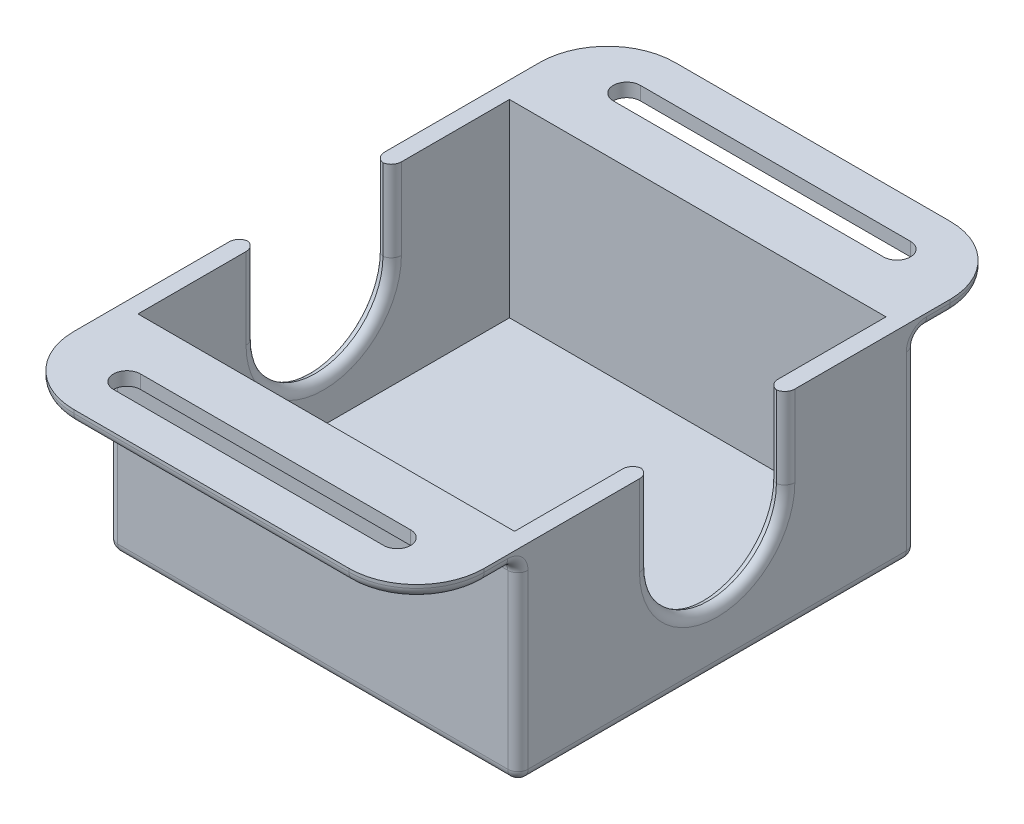
from build123d import *

# Parameters (mm, degrees)
BOSS_EXTRUDE1_DEPTH      = 27.5
BOSS_EXTRUDE1_DEPTH_BACK = 27.5
SKETCH3_W                = 60.75
SKETCH3_H                = 30.5
BOSS_EXTRUDE2_DEPTH      = 2
SKETCH4_W                = 55.75
SKETCH4_H                = 55
CUT_EXTRUDE1_DEPTH       = 50
SKETCH5_W                = 60.75
SKETCH5_H                = 30.5
BOSS_EXTRUDE3_DEPTH      = 2
SKETCH7_W                = 5.5
SKETCH7_H                = 4
CUT_EXTRUDE2_DEPTH       = 2
SKETCH8_W                = 60.75
SKETCH8_H                = 15
BOSS_EXTRUDE5_DEPTH      = 2
FILLET2_R                = 10
CUT_EXTRUDE3_DEPTH       = 62.425895394
CUT_EXTRUDE3_DEPTH_BACK  = 62.425895394
SKETCH10_W               = 5.5
SKETCH10_H               = 5.017361003
CUT_EXTRUDE4_DEPTH       = 4
DELETEFACE1_START        = -29
DELETEFACE1_OUTLINE_W    = 5.5
DELETEFACE1_OUTLINE_H    = 4
DELETEFACE1_DEPTH        = 2
SKETCH11_W               = 46.425527042
SKETCH11_H               = 17.437880889
BOSS_EXTRUDE6_DEPTH      = 0.8
FILLET3_R                = 1.5


# Read off the part's stored shape, not the designer's step: DeleteFace1
with BuildPart() as part:
    # Sketch2 → Boss-Extrude1 (new, two sides: drawn at the far end of the back side and taken through both)
    with BuildSketch(Plane.XY.offset(-BOSS_EXTRUDE1_DEPTH_BACK)):
        Polygon((-23.875, -1.5), (-27.875, -1.5), (-27.875, -27), (0, -27), (27.875, -27), (27.875, -1.5), (23.875, -1.5), (23.875, 1), (30.375, 1), (30.375, -29.5), (0, -29.5), (-30.375, -29.5), (-30.375, 1), (-23.875, 1), align=None)
    extrude(amount=BOSS_EXTRUDE1_DEPTH + BOSS_EXTRUDE1_DEPTH_BACK)

    # Sketch3 → Boss-Extrude2 (add)
    with BuildSketch(Plane(origin=(0, 0, -27.5), x_dir=(-1, 0, 0), z_dir=(0, 0, -1))):
        with Locations((0, -14.25)):
            Rectangle(SKETCH3_W, SKETCH3_H)
    extrude(amount=BOSS_EXTRUDE2_DEPTH)

    # Sketch4 → Cut-Extrude1 (cut)
    with BuildSketch(Plane(origin=(0, -27, 0), x_dir=(1, 0, 0), z_dir=(0, 1, 0))):
        Rectangle(SKETCH4_W, SKETCH4_H)
    extrude(amount=CUT_EXTRUDE1_DEPTH, mode=Mode.SUBTRACT)

    # Sketch5 → Boss-Extrude3 (add)
    with BuildSketch(Plane.XY.offset(27.5)):
        with Locations((0, -14.25)):
            Rectangle(SKETCH5_W, SKETCH5_H)
    extrude(amount=BOSS_EXTRUDE3_DEPTH)

    # Sketch7 → Cut-Extrude2 (cut)
    with BuildSketch(Plane(origin=(0, -27, 0), x_dir=(1, 0, 0), z_dir=(0, 1, 0))):
        with Locations((0, 20)):
            Rectangle(SKETCH7_W, SKETCH7_H)
        with Locations((17.5, 20)):
            Rectangle(SKETCH7_W, SKETCH7_H)
        with Locations((-17.5, 20)):
            Rectangle(SKETCH7_W, SKETCH7_H)
    extrude(amount=-CUT_EXTRUDE2_DEPTH, mode=Mode.SUBTRACT)

    # Sketch8 → Boss-Extrude5 (add)
    # profile 1 of 2: a face of its own
    with BuildSketch(Plane(origin=(0, 1, 0), x_dir=(1, 0, 0), z_dir=(0, 1, 0))):
        with Locations((0, 37)):
            Rectangle(SKETCH8_W, SKETCH8_H)
        with BuildLine():
            Line((-20, 39), (20, 39))
            ThreePointArc((20, 39), (22, 37), (20, 35))
            Line((20, 35), (-20, 35))
            ThreePointArc((-20, 35), (-22, 37), (-20, 39))
        make_face(mode=Mode.SUBTRACT)
    # profile 2 of 2: a face of its own
    with BuildSketch(Plane(origin=(0, 1, 0), x_dir=(1, 0, 0), z_dir=(0, 1, 0))):
        with Locations((0, -37)):
            Rectangle(SKETCH8_W, SKETCH8_H)
        with BuildLine():
            Line((-20, -35), (20, -35))
            ThreePointArc((20, -35), (22, -37), (20, -39))
            Line((20, -39), (-20, -39))
            ThreePointArc((-20, -39), (-22, -37), (-20, -35))
        make_face(mode=Mode.SUBTRACT)
    extrude(amount=-BOSS_EXTRUDE5_DEPTH)

    # Fillet2
    fillet2_edges = [part.edges().sort_by_distance(p)[0] for p in [
        (-30.375, 0, -44.5),
        (30.375, 0, -44.5),
        (-30.375, 0, 44.5),
        (30.375, 0, 44.5),
    ]]
    fillet(fillet2_edges, radius=FILLET2_R)

    # Sketch9 → Cut-Extrude3 (cut, two sides: drawn at the far end of the back side and taken through both)
    with BuildSketch(Plane(origin=(0, 0, 0), x_dir=(0, 0, -1), z_dir=(1, 0, 0)).offset(-CUT_EXTRUDE3_DEPTH_BACK)):
        with BuildLine():
            Line((10, 13), (10, -11))
            ThreePointArc((10, -11), (0, -21), (-10, -11))
            Line((-10, -11), (-10, 13))
            ThreePointArc((-10, 13), (0, 23), (10, 13))
        make_face()
    extrude(amount=CUT_EXTRUDE3_DEPTH + CUT_EXTRUDE3_DEPTH_BACK, mode=Mode.SUBTRACT)

    # Sketch10 → Cut-Extrude4 (cut)
    with BuildSketch(Plane(origin=(0, 0, -18), x_dir=(-1, 0, 0), z_dir=(0, 0, -1))):
        with Locations((17.5, -30.308680501)):
            Rectangle(SKETCH10_W, SKETCH10_H)
        with Locations((-17.5, -30.308680501)):
            Rectangle(SKETCH10_W, SKETCH10_H)
    extrude(amount=CUT_EXTRUDE4_DEPTH, mode=Mode.SUBTRACT)

    # DeleteFace1 outline → DeleteFace1 (add)
    with BuildSketch(Plane(origin=(0, 0, 0), x_dir=(1, 0, 0), z_dir=(0, 1, 0)).offset(DELETEFACE1_START)):
        with Locations((0, 20)):
            Rectangle(DELETEFACE1_OUTLINE_W, DELETEFACE1_OUTLINE_H)
    extrude(amount=DELETEFACE1_DEPTH)

    # Sketch11 → Boss-Extrude6 (add)
    with BuildSketch(Plane(origin=(0, -27, 0), x_dir=(1, 0, 0), z_dir=(0, 1, 0))):
        with Locations((0, 15.626153005)):
            Rectangle(SKETCH11_W, SKETCH11_H)
    extrude(amount=-BOSS_EXTRUDE6_DEPTH)

    # Fillet3
    # the kernel refuses this fillet: 1.5 mm, written as the material it adds along each edge
    with BuildSketch(Plane(origin=(-30.375, -1, 29.5), x_dir=(0, 0, 1), z_dir=(1, 0, 0)), Plane(origin=(-30.375, -1, -29.5), x_dir=(0, -1, 0), z_dir=(1, 0, 0))) as fillet3_piece_1:
        with BuildLine():
            CenterArc((FILLET3_R, FILLET3_R), FILLET3_R, 180, 90)
            Line((0, FILLET3_R), (0, 0))
            Line((0, 0), (FILLET3_R, 0))
        make_face()
    extrude(amount=60.75)
    # the kernel refuses this fillet: 1.5 mm, written as the material it takes off along each edge
    with BuildSketch(Plane(origin=(-30.375, -29.5, -33.25), x_dir=(0, 1, 0), z_dir=(0, 0, 1)), Plane(origin=(30.375, -29.5, 33.25), x_dir=(0, 1, 0), z_dir=(0, 0, -1))) as fillet3_2_piece_1:
        with BuildLine():
            CenterArc((FILLET3_R, -FILLET3_R), FILLET3_R, 90, 90)
            Line((0, -FILLET3_R), (0, 0))
            Line((0, 0), (FILLET3_R, 0))
        make_face()
    extrude(amount=66.5, mode=Mode.SUBTRACT)
    with BuildSketch(Plane(origin=(34.125, -29.5, 29.5), x_dir=(0, 1, 0), z_dir=(-1, 0, 0))) as fillet3_2_piece_2:
        with BuildLine():
            CenterArc((FILLET3_R, FILLET3_R), FILLET3_R, 180, 90)
            Line((0, FILLET3_R), (0, 0))
            Line((0, 0), (FILLET3_R, 0))
        make_face()
    extrude(amount=68.25, mode=Mode.SUBTRACT)
    with BuildSketch(Plane(origin=(-34.125, -29.5, -29.5), x_dir=(0, 0, 1), z_dir=(1, 0, 0))) as fillet3_2_piece_3:
        with BuildLine():
            CenterArc((FILLET3_R, -FILLET3_R), FILLET3_R, 90, 90)
            Line((0, -FILLET3_R), (0, 0))
            Line((0, 0), (FILLET3_R, 0))
        make_face()
    extrude(amount=68.25, mode=Mode.SUBTRACT)
    with BuildSketch(Plane(origin=(-30.375, -11, 10), x_dir=(0, 0, 1), z_dir=(0, 1, 0)), Plane(origin=(-30.375, 4.75, -10), x_dir=(0, 0, -1), z_dir=(0, -1, 0)), Plane(origin=(30.375, -11, -10), x_dir=(0, 0, -1), z_dir=(0, 1, 0)), Plane(origin=(-27.875, -11, -10), x_dir=(0, 0, -1), z_dir=(0, 1, 0)), Plane(origin=(27.875, 4.75, -10), x_dir=(0, 0, -1), z_dir=(0, -1, 0)), Plane(origin=(27.875, -11, 10), x_dir=(0, 0, 1), z_dir=(0, 1, 0))) as fillet3_2_piece_4:
        with BuildLine():
            CenterArc((FILLET3_R, FILLET3_R), FILLET3_R, 180, 90)
            Line((0, FILLET3_R), (0, 0))
            Line((0, 0), (FILLET3_R, 0))
        make_face()
    extrude(amount=15.75, mode=Mode.SUBTRACT)
    with BuildSketch(Plane(origin=(30.375, 4.75, 10), x_dir=(-1, 0, 0), z_dir=(0, -1, 0)), Plane(origin=(-27.875, 4.75, 10), x_dir=(-1, 0, 0), z_dir=(0, -1, 0))) as fillet3_2_piece_5:
        with BuildLine():
            CenterArc((FILLET3_R, -FILLET3_R), FILLET3_R, 90, 90)
            Line((0, -FILLET3_R), (0, 0))
            Line((0, 0), (FILLET3_R, 0))
        make_face()
    extrude(amount=15.75, mode=Mode.SUBTRACT)
    with BuildSketch(Plane(origin=(-30.375, -11, 0), x_dir=(0, 0, -1), z_dir=(0, 1, 0))) as fillet3_2_piece_6:
        with BuildLine():
            CenterArc((10 + FILLET3_R, -FILLET3_R), FILLET3_R, 90, 90)
            Line((10, -FILLET3_R), (10, 0))
            Line((10, 0), (10 + FILLET3_R, 0))
        make_face()
    revolve(axis=Axis((-30.375, -11, 0), (-1, 0, 0)), revolution_arc=180, mode=Mode.SUBTRACT)
    with BuildSketch(Plane(origin=(30.375, -11, 0), x_dir=(0, 0, -1), z_dir=(0, 1, 0))) as fillet3_2_piece_7:
        with BuildLine():
            CenterArc((10 + FILLET3_R, FILLET3_R), FILLET3_R, 180, 90)
            Line((10, FILLET3_R), (10, 0))
            Line((10, 0), (10 + FILLET3_R, 0))
        make_face()
    revolve(axis=Axis((30.375, -11, 0), (-1, 0, 0)), revolution_arc=180, mode=Mode.SUBTRACT)
    with BuildSketch(Plane(origin=(-27.875, -11, 0), x_dir=(0, 0, -1), z_dir=(0, 1, 0))) as fillet3_2_piece_8:
        with BuildLine():
            CenterArc((10 + FILLET3_R, FILLET3_R), FILLET3_R, 180, 90)
            Line((10, FILLET3_R), (10, 0))
            Line((10, 0), (10 + FILLET3_R, 0))
        make_face()
    revolve(axis=Axis((-27.875, -11, 0), (-1, 0, 0)), revolution_arc=180, mode=Mode.SUBTRACT)
    with BuildSketch(Plane(origin=(27.875, -11, 0), x_dir=(0, 0, -1), z_dir=(0, 1, 0))) as fillet3_2_piece_9:
        with BuildLine():
            CenterArc((10 + FILLET3_R, -FILLET3_R), FILLET3_R, 90, 90)
            Line((10, -FILLET3_R), (10, 0))
            Line((10, 0), (10 + FILLET3_R, 0))
        make_face()
    revolve(axis=Axis((27.875, -11, 0), (-1, 0, 0)), revolution_arc=180, mode=Mode.SUBTRACT)
    # the kernel refuses this fillet: 1.5 mm, written as the material it takes off along each edge
    with BuildSketch(Plane(origin=(28.875, -28, -28), x_dir=(0, 0, -1), z_dir=(1, 0, 0))) as fillet3_3_piece_1_section:
        Polygon((0, 0), (FILLET3_R, 0), (FILLET3_R, -FILLET3_R), (0, -FILLET3_R), align=None)
    fillet3_3_piece_1 = extrude(amount=FILLET3_R, mode=Mode.PRIVATE)
    fillet3_3_piece_1 = fillet3_3_piece_1 - Plane(origin=(28.875, -28, -28), x_dir=(0, 0.7071067811865475, 0.7071067811865475), z_dir=(1, 0, 0)) * Sphere(FILLET3_R, mode=Mode.PRIVATE)
    add(fillet3_3_piece_1, mode=Mode.SUBTRACT)
    with BuildSketch(Plane(origin=(28.875, -28, 28), x_dir=(0, 0, 1), z_dir=(1, 0, 0))) as fillet3_3_piece_2_section:
        Polygon((0, 0), (FILLET3_R, 0), (FILLET3_R, FILLET3_R), (0, FILLET3_R), align=None)
    fillet3_3_piece_2 = extrude(amount=FILLET3_R, mode=Mode.PRIVATE)
    fillet3_3_piece_2 = fillet3_3_piece_2 - Plane(origin=(28.875, -28, 28), x_dir=(0, 0.7071067811865475, -0.7071067811865475), z_dir=(1, 0, 0)) * Sphere(FILLET3_R, mode=Mode.PRIVATE)
    add(fillet3_3_piece_2, mode=Mode.SUBTRACT)
    with BuildSketch(Plane(origin=(-28.875, -28, -28), x_dir=(0, 0, -1), z_dir=(-1, 0, 0))) as fillet3_3_piece_3_section:
        Polygon((0, 0), (FILLET3_R, 0), (FILLET3_R, FILLET3_R), (0, FILLET3_R), align=None)
    fillet3_3_piece_3 = extrude(amount=FILLET3_R, mode=Mode.PRIVATE)
    fillet3_3_piece_3 = fillet3_3_piece_3 - Plane(origin=(-28.875, -28, -28), x_dir=(0, 0.7071067811865475, 0.7071067811865475), z_dir=(-1, 0, 0)) * Sphere(FILLET3_R, mode=Mode.PRIVATE)
    add(fillet3_3_piece_3, mode=Mode.SUBTRACT)
    with BuildSketch(Plane(origin=(-28.875, -28, 28), x_dir=(0, 0, 1), z_dir=(-1, 0, 0))) as fillet3_3_piece_4_section:
        Polygon((0, 0), (FILLET3_R, 0), (FILLET3_R, -FILLET3_R), (0, -FILLET3_R), align=None)
    fillet3_3_piece_4 = extrude(amount=FILLET3_R, mode=Mode.PRIVATE)
    fillet3_3_piece_4 = fillet3_3_piece_4 - Plane(origin=(-28.875, -28, 28), x_dir=(0, 0.7071067811865475, -0.7071067811865475), z_dir=(-1, 0, 0)) * Sphere(FILLET3_R, mode=Mode.PRIVATE)
    add(fillet3_3_piece_4, mode=Mode.SUBTRACT)
    with BuildSketch(Plane(origin=(20.375, -1, 44.5), x_dir=(0, 1, 0), z_dir=(-1, 0, 0)), Plane(origin=(20.375, -1, -44.5), x_dir=(0, 0, 1), z_dir=(-1, 0, 0))) as fillet3_3_piece_5:
        with BuildLine():
            CenterArc((FILLET3_R, FILLET3_R), FILLET3_R, 180, 90)
            Line((0, FILLET3_R), (0, 0))
            Line((0, 0), (FILLET3_R, 0))
        make_face()
    extrude(amount=40.75, mode=Mode.SUBTRACT)
    with BuildSketch(Plane(origin=(-20.375, -1, 34.5), x_dir=(-1, 0, 0), z_dir=(0, 0, -1))) as fillet3_3_piece_6:
        with BuildLine():
            CenterArc((10 - FILLET3_R, FILLET3_R), FILLET3_R, 270, 90)
            Line((10 - FILLET3_R, 0), (10, 0))
            Line((10, 0), (10, FILLET3_R))
        make_face()
    revolve(axis=Axis((-20.375, -1, 34.5), (0, 1, 0)), revolution_arc=90, mode=Mode.SUBTRACT)
    with BuildSketch(Plane(origin=(-20.375, -1, -34.5), x_dir=(-1, 0, 0), z_dir=(0, 0, 1))) as fillet3_3_piece_7:
        with BuildLine():
            CenterArc((10 - FILLET3_R, -FILLET3_R), FILLET3_R, 0, 90)
            Line((10, -FILLET3_R), (10, 0))
            Line((10, 0), (10 - FILLET3_R, 0))
        make_face()
    revolve(axis=Axis((-20.375, -1, -34.5), (0, -1, 0)), revolution_arc=90, mode=Mode.SUBTRACT)
    with BuildSketch(Plane(origin=(20.375, -1, 34.5), x_dir=(1, 0, 0), z_dir=(0, 0, -1))) as fillet3_3_piece_8:
        with BuildLine():
            CenterArc((10 - FILLET3_R, -FILLET3_R), FILLET3_R, 0, 90)
            Line((10 - FILLET3_R, 0), (10, 0))
            Line((10, 0), (10, -FILLET3_R))
        make_face()
    revolve(axis=Axis((20.375, -1, 34.5), (0, -1, 0)), revolution_arc=90, mode=Mode.SUBTRACT)
    with BuildSketch(Plane(origin=(-30.375, -1, 34.5), x_dir=(0, 1, 0), z_dir=(0, 0, -1)), Plane(origin=(30.375, -1, 31), x_dir=(0, 1, 0), z_dir=(0, 0, 1))) as fillet3_3_piece_9:
        with BuildLine():
            CenterArc((FILLET3_R, FILLET3_R), FILLET3_R, 180, 90)
            Line((0, FILLET3_R), (0, 0))
            Line((0, 0), (FILLET3_R, 0))
        make_face()
    extrude(amount=3.5, mode=Mode.SUBTRACT)
    with BuildSketch(Plane(origin=(-30.375, -1, -34.5), x_dir=(0, 1, 0), z_dir=(0, 0, 1)), Plane(origin=(30.375, -1, -31), x_dir=(0, 1, 0), z_dir=(0, 0, -1))) as fillet3_3_piece_10:
        with BuildLine():
            CenterArc((FILLET3_R, -FILLET3_R), FILLET3_R, 90, 90)
            Line((0, -FILLET3_R), (0, 0))
            Line((0, 0), (FILLET3_R, 0))
        make_face()
    extrude(amount=3.5, mode=Mode.SUBTRACT)
    with BuildSketch(Plane(origin=(20.375, -1, -34.5), x_dir=(0, 0, -1), z_dir=(-1, 0, 0))) as fillet3_3_piece_11:
        with BuildLine():
            CenterArc((10 - FILLET3_R, -FILLET3_R), FILLET3_R, 0, 90)
            Line((10, -FILLET3_R), (10, 0))
            Line((10, 0), (10 - FILLET3_R, 0))
        make_face()
    revolve(axis=Axis((20.375, -1, -34.5), (0, -1, 0)), revolution_arc=90, mode=Mode.SUBTRACT)
    with BuildSketch(Plane(origin=(-30.375, -28, 29.5), x_dir=(0, 0, -1), z_dir=(0, 1, 0)), Plane(origin=(-30.375, -2.5, -29.5), x_dir=(0, 0, 1), z_dir=(0, -1, 0)), Plane(origin=(30.375, -2.5, 29.5), x_dir=(0, 0, -1), z_dir=(0, -1, 0)), Plane(origin=(30.375, -28, -29.5), x_dir=(0, 0, 1), z_dir=(0, 1, 0))) as fillet3_3_piece_12:
        with BuildLine():
            CenterArc((FILLET3_R, -FILLET3_R), FILLET3_R, 90, 90)
            Line((0, -FILLET3_R), (0, 0))
            Line((0, 0), (FILLET3_R, 0))
        make_face()
    extrude(amount=25.5, mode=Mode.SUBTRACT)
    with BuildSketch(Plane(origin=(30.375, -2.5, -31), x_dir=(0, 0, 1), z_dir=(0, -1, 0))) as fillet3_3_piece_13:
        with BuildLine():
            CenterArc((1.5 + FILLET3_R, FILLET3_R), FILLET3_R, 180, 90)
            Line((1.5, FILLET3_R), (1.5, 0))
            Line((1.5, 0), (1.5 + FILLET3_R, 0))
        make_face()
    revolve(axis=Axis((30.375, -2.5, -31), (-1, 0, 0)), revolution_arc=90, mode=Mode.SUBTRACT)
    with BuildSketch(Plane(origin=(30.375, -2.5, 31), x_dir=(0, 1, 0), z_dir=(0, 0, 1))) as fillet3_3_piece_14:
        with BuildLine():
            CenterArc((1.5 + FILLET3_R, FILLET3_R), FILLET3_R, 180, 90)
            Line((1.5, FILLET3_R), (1.5, 0))
            Line((1.5, 0), (1.5 + FILLET3_R, 0))
        make_face()
    revolve(axis=Axis((30.375, -2.5, 31), (-1, 0, 0)), revolution_arc=90, mode=Mode.SUBTRACT)
    with BuildSketch(Plane(origin=(-30.375, -2.5, -31), x_dir=(0, 0, 1), z_dir=(0, -1, 0))) as fillet3_3_piece_15:
        with BuildLine():
            CenterArc((1.5 + FILLET3_R, -FILLET3_R), FILLET3_R, 90, 90)
            Line((1.5, -FILLET3_R), (1.5, 0))
            Line((1.5, 0), (1.5 + FILLET3_R, 0))
        make_face()
    revolve(axis=Axis((-30.375, -2.5, -31), (-1, 0, 0)), revolution_arc=90, mode=Mode.SUBTRACT)
    with BuildSketch(Plane(origin=(-30.375, -2.5, 31), x_dir=(0, 1, 0), z_dir=(0, 0, 1))) as fillet3_3_piece_16:
        with BuildLine():
            CenterArc((1.5 + FILLET3_R, -FILLET3_R), FILLET3_R, 90, 90)
            Line((1.5, -FILLET3_R), (1.5, 0))
            Line((1.5, 0), (1.5 + FILLET3_R, 0))
        make_face()
    revolve(axis=Axis((-30.375, -2.5, 31), (-1, 0, 0)), revolution_arc=90, mode=Mode.SUBTRACT)


solid = part.part
